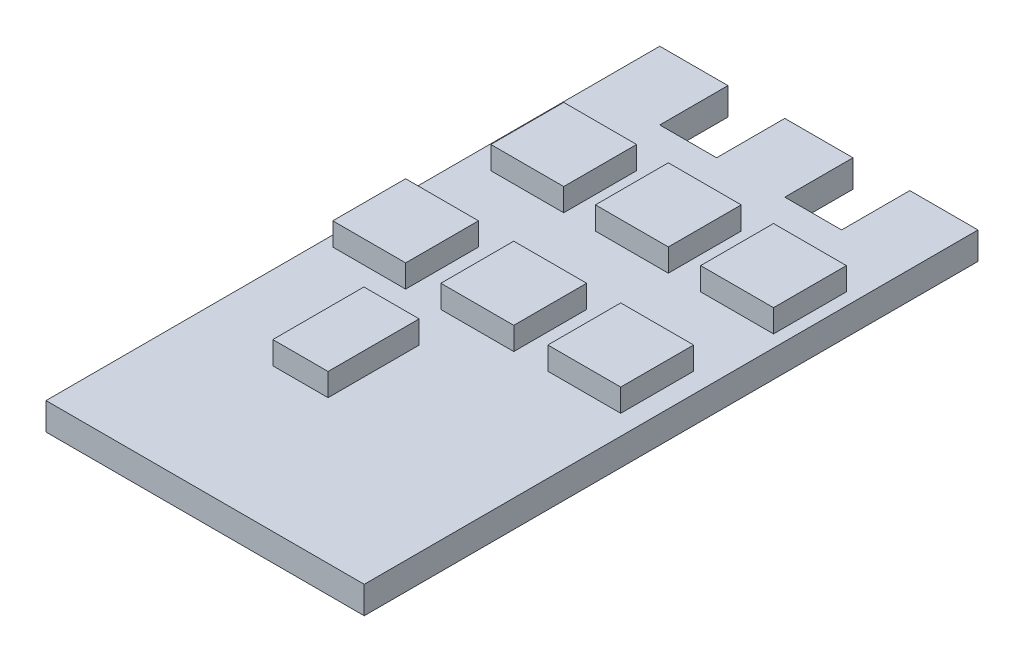
from build123d import *

# Parameters (mm, degrees)
PCB_DEPTH               = 1.2
SKETCH2_W               = 3.205722041
SKETCH2_H               = 3.205722042
SKETCH2_W_2             = 3.205722042
SKETCH2_W_3             = 2.430144128
SKETCH2_H_2             = 4.007152552
TOP_COMPONENTS_DEPTH    = 1
SKETCH3_W               = 4.033005149
SKETCH3_H               = 4.058308378
SKETCH3_W_2             = 3.102311653
SKETCH3_H_2             = 2.921343474
SKETCH3_W_3             = 2.817933085
SKETCH3_W_4             = 2.869638279
SKETCH3_W_5             = 1.835534395
SKETCH3_H_3             = 3.12816425
BOTTOM_COMPONENTS_DEPTH = 1


with BuildPart() as part:
    # Sketch1 → PCB (new body)
    with BuildSketch(Plane(origin=(0, 0, 0), x_dir=(1, 0, 0), z_dir=(0, 1, 0))):
        Polygon((-7, 15), (-7, -12), (7, -12), (7, 15), (4, 15), (4, 12), (1.5, 12), (1.5, 15), (-1.5, 15), (-1.5, 12), (-4, 12), (-4, 15), align=None)
    extrude(amount=PCB_DEPTH)

    # Sketch2 → Top components (add)
    with BuildSketch(Plane(origin=(0, 1.2, 0), x_dir=(1, 0, 0), z_dir=(0, 1, 0))):
        with Locations((-4.369088912, 8.144117457)):
            Rectangle(SKETCH2_W, SKETCH2_H)
        with Locations((0.232673374, 8.144117457)):
            Rectangle(SKETCH2_W_2, SKETCH2_H)
        with Locations((4.860288257, 8.144117457)):
            Rectangle(SKETCH2_W, SKETCH2_H)
        with Locations((-4.937846048, 1.758525971)):
            Rectangle(SKETCH2_W_2, SKETCH2_H)
        with Locations((-0.18096818, 1.758525971)):
            Rectangle(SKETCH2_W_2, SKETCH2_H)
        with Locations((4.524204494, 1.758525971)):
            Rectangle(SKETCH2_W_2, SKETCH2_H)
        with Locations((-2.119912963, -3.68344572)):
            Rectangle(SKETCH2_W_3, SKETCH2_H_2)
    extrude(amount=TOP_COMPONENTS_DEPTH)

    # Sketch3 → Bottom components (add)
    with BuildSketch(Plane.XZ):
        with Locations((-0.775577914, 2.029154189)):
            Rectangle(SKETCH3_W, SKETCH3_H)
        with Locations((-4.343236315, -5.442521059)):
            Rectangle(SKETCH3_W_2, SKETCH3_H_2)
        with Locations((0.090484089, -5.442521059)):
            Rectangle(SKETCH3_W_3, SKETCH3_H_2)
        with Locations((4.511278196, -5.442521059)):
            Rectangle(SKETCH3_W_4, SKETCH3_H_2)
        with Locations((4.433720405, 7.923271646)):
            Rectangle(SKETCH3_W_5, SKETCH3_H_3)
    extrude(amount=BOTTOM_COMPONENTS_DEPTH)


solid = part.part
